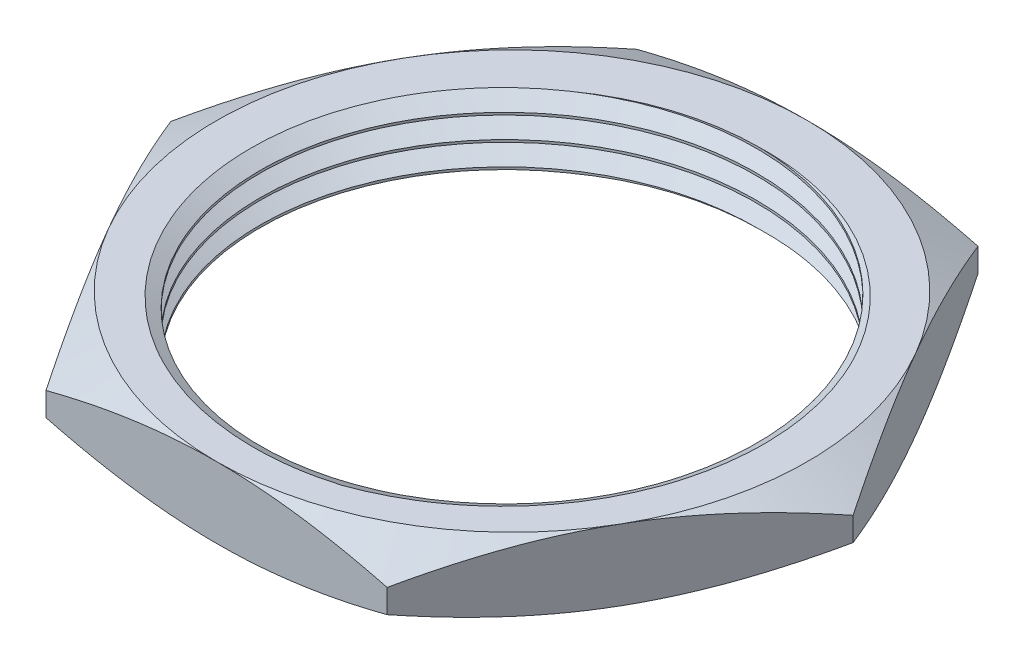
from build123d import *

# Parameters (mm, degrees)
SKETCH_1_R      = 10.5
EXTRUDE_1_DEPTH = 3
SWEEP_1_PITCH   = 1


with BuildPart() as part:
    # 草图1 → 凸台-拉伸1 (new body)
    with BuildSketch(Plane(origin=(0, 0, 0), x_dir=(1, 0, 0), z_dir=(0, 1, 0))):
        Polygon((7.216878365, -12.5), (14.43375673, 0), (7.216878365, 12.5), (-7.216878365, 12.5), (-14.43375673, 0), (-7.216878365, -12.5), align=None)
        with Locations(Location((0, 0, 0), (0, 0, 270))):
            Circle(SKETCH_1_R, mode=Mode.SUBTRACT)
    extrude(amount=EXTRUDE_1_DEPTH)

    # 切除-扫描1: arcs per turn and ends read off the stored shape
    # 切除-扫描1: the profile of 草图8 profile screwed along a right-hand helix through 4.5 turns, 8 arcs to a turn; built about Z, then put on its axis
    sweep_1_z = Axis((0, 0, 0), (0, 0, 1))
    sweep_1_corners = [(10.4997, 0, -1.000173205), (10.4997, 0, -0.099826795), (11.279422863, 0, -0.55)]
    with BuildLine(mode=Mode.PRIVATE) as sweep_1_profile:
        Line(sweep_1_corners[0], sweep_1_corners[1])
        Line(sweep_1_corners[1], sweep_1_corners[2])
        Line(sweep_1_corners[2], sweep_1_corners[0])
    sweep_1_cap = Face(sweep_1_profile.wire())
    sweep_1_turn_angles = [0, 22.5, 45, 67.5, 90, 112.5, 135, 157.5, 180, 202.5, 225, 247.5, 270, 292.5, 315, 337.5, 360]
    sweep_1_turn_weights = [1, 0.9238795325112867, 1, 0.9238795325112867, 1, 0.9238795325112867, 1, 0.9238795325112867, 1, 0.9238795325112867, 1, 0.9238795325112867, 1, 0.9238795325112867, 1, 0.9238795325112867, 1]
    sweep_1_turn_rails = [Edge.make_bspline([Vector(p[0], p[1], 0).rotate(sweep_1_z, sweep_1_turn_angles[k]) / sweep_1_turn_weights[k] + Vector(0, 0, p[2] + SWEEP_1_PITCH * sweep_1_turn_angles[k] / 360) for k in range(17)], [0, 0, 0, 1, 1, 2, 2, 3, 3, 4, 4, 5, 5, 6, 6, 7, 7, 8, 8, 8], 2, sweep_1_turn_weights) for p in sweep_1_corners]
    sweep_1_turn_sides = [Face.make_surface_from_curves(sweep_1_turn_rails[p[0]], sweep_1_turn_rails[p[1]]) for p in [(0, 1), (1, 2), (2, 0)]]
    sweep_1_last_angles = [1440, 1462.5, 1485, 1507.5, 1530, 1552.5, 1575, 1597.5, 1620]
    sweep_1_last_weights = [1, 0.9238795325112867, 1, 0.9238795325112867, 1, 0.9238795325112867, 1, 0.9238795325112867, 1]
    sweep_1_last_rails = [Edge.make_bspline([Vector(p[0], p[1], 0).rotate(sweep_1_z, sweep_1_last_angles[k]) / sweep_1_last_weights[k] + Vector(0, 0, p[2] + SWEEP_1_PITCH * sweep_1_last_angles[k] / 360) for k in range(9)], [0, 0, 0, 1, 1, 2, 2, 3, 3, 4, 4, 4], 2, sweep_1_last_weights) for p in sweep_1_corners]
    sweep_1_last_sides = [Face.make_surface_from_curves(sweep_1_last_rails[p[0]], sweep_1_last_rails[p[1]]) for p in [(0, 1), (1, 2), (2, 0)]]
    sweep_1 = Plane(origin=(0, 0, 0), x_dir=(0, 0, -1), z_dir=(0, 1, 0)) * Solid(Shell([*[p.moved(Location((0, 0, SWEEP_1_PITCH * i))) for i in range(4) for p in sweep_1_turn_sides], *sweep_1_last_sides, sweep_1_cap, sweep_1_cap.rotate(sweep_1_z, 1620).moved(Location((0, 0, SWEEP_1_PITCH * 1620 / 360)))]))
    add(sweep_1, mode=Mode.SUBTRACT)

    # 草图9 → 切除-旋转5 (revolve, cut)
    with BuildSketch(Plane(origin=(0, 0, 0), x_dir=(0, 0, -1), z_dir=(1, 0, 0))):
        Polygon((14.43375673, 2), (12.5, 3), (14.43375673, 3), align=None)
        Polygon((14.43375673, 1), (14.43375673, 0), (12.5, 0), align=None)
    revolve(axis=Axis((0, -1.961998649, 0), (0, 1, 0)), mode=Mode.SUBTRACT)


solid = part.part
